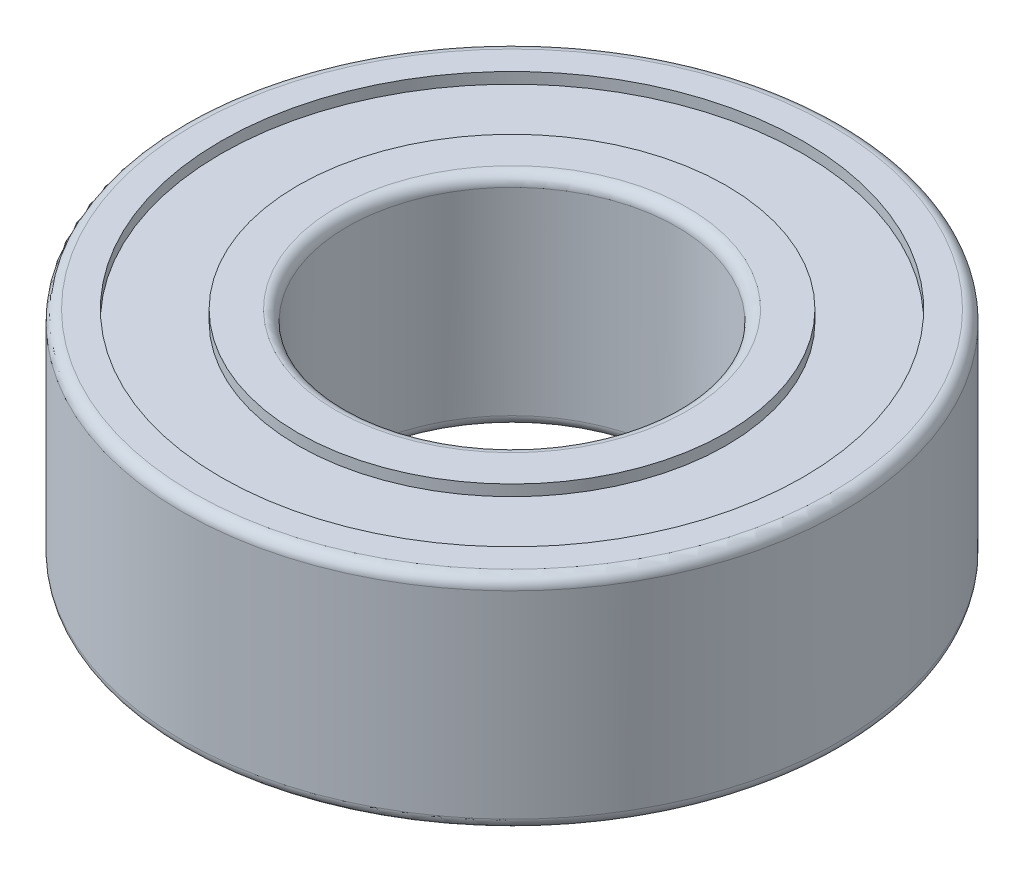
from build123d import *

# Parameters (mm, degrees)
FILLET1_R            = 0.2
FILLET1_OF_MIRROR1_R = 0.2


with BuildPart() as part:
    # Sketch1 → Revolve1 (revolve)
    with BuildSketch(Plane(origin=(0, 0, 0), x_dir=(0, 0, -1), z_dir=(1, 0, 0))):
        Polygon((-6, 0), (-6, 2), (-5.3, 2), (-5.3, 1.8), (-3.9, 1.8), (-3.9, 2), (-3, 2), (-3, 0), align=None)
    revolve1 = revolve(axis=Axis((0, 15.203883495, 0), (0, -1, 0)))

    # Fillet1
    fillet1_edges = [part.edges().sort_by_distance(p)[0] for p in [
        (0, 2, -6),
        (0, 2, -3),
    ]]
    fillet(fillet1_edges, radius=FILLET1_R)

    # Mirror1: Revolve1 across plane
    add(revolve1.mirror(Plane.ZX))

    # Fillet1 of Mirror1
    fillet1_of_mirror1_edges = [part.edges().sort_by_distance(p)[0] for p in [
        (0, -2, -6),
        (0, -2, -3),
    ]]
    fillet(fillet1_of_mirror1_edges, radius=FILLET1_OF_MIRROR1_R)


solid = part.part
